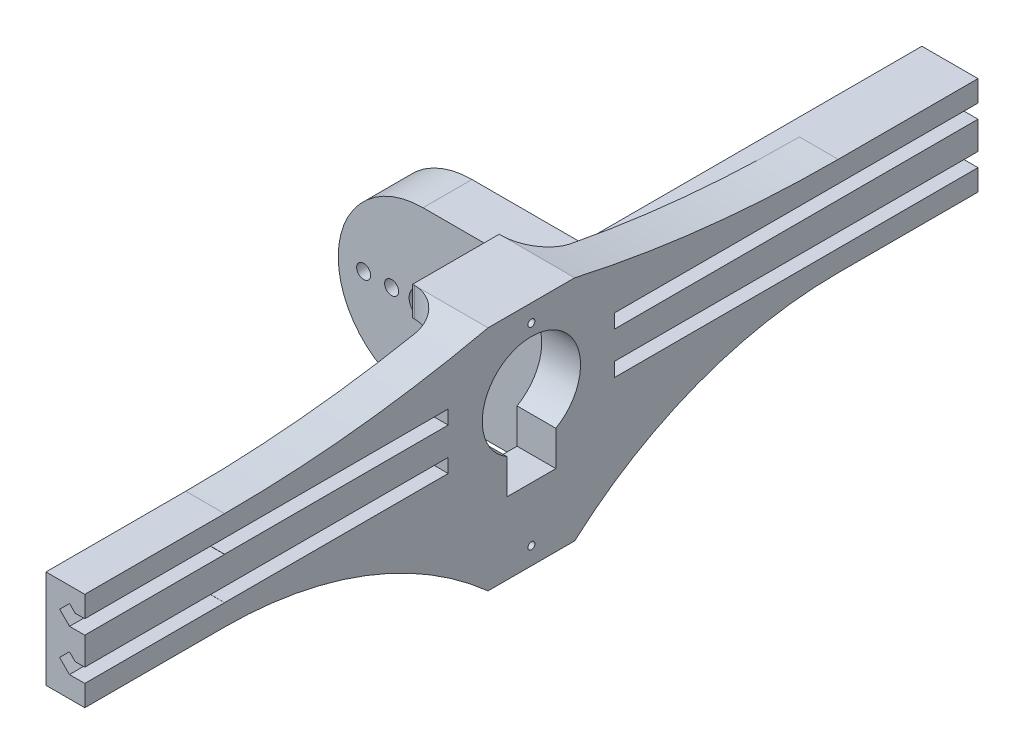
from build123d import *

# Parameters (mm, degrees)
SKETCH1_R               = 2
BOSS_EXTRUDE3_DEPTH     = 7
SKETCH3_R               = 1.0000000000000002
SKETCH3_R_2             = 0.9999999999999998
SKETCH3_R_3             = 0.9999999999999996
SKETCH3_R_4             = 0.9999999999999993
CUT_EXTRUDE2_DEPTH      = 26.09227496303999
BOSS_EXTRUDE4_START     = -7
BOSS_EXTRUDE4_DEPTH     = 7
BOSS_EXTRUDE5_START     = -30
BOSS_EXTRUDE5_DEPTH     = 30
FILLET2_R               = 1.5
CUT_EXTRUDE5_DEPTH      = 42.36510924463761
BOSS_EXTRUDE6_DEPTH     = 10.5
MOVE_START              = -28.7
MOVE_FACE1_DEPTH        = 5.7
DELETEFACE1_START       = 23.7
DELETEFACE1_OUTLINE_W   = 10.499999999999998
DELETEFACE1_OUTLINE_H   = 35.699999999999996
DELETEFACE1_DEPTH       = 15.7
SKETCH11_OUTSIDE_W      = 51.876
SKETCH11_OUTSIDE_H      = 42.462
CUT_EXTRUDE6_DEPTH      = 46.16926949380307
SERVO_START             = -12.760864102
SERVO_MICRO_OUTLINE_W   = 22.6
SERVO_MICRO_OUTLINE_H   = 12.399999999999999
SERVO_MICRO_DEPTH       = 22.3
SERVO_START_2           = 9.539135898
SERVO_MICRO_2_DEPTH     = 4.3
SERVO_START_3           = 2.889135898
SERVO_MICRO_3_DEPTH     = 2.4
SERVO_START_4           = 13.839135898
SERVO_MICRO_4_OUTLINE_R = 2.5
SERVO_MICRO_4_DEPTH     = 3.3
SERVO_START_5           = -25.667487826
SERVO_MICRO_5_OUTLINE_R = 0.6
SERVO_MICRO_5_DEPTH     = 2.3
SERVO_MICRO_6_OUTLINE_R = 0.6
SERVO_MICRO_6_DEPTH     = 2.3
SERVO_MICRO_7_OUTLINE_R = 0.6
SERVO_MICRO_7_DEPTH     = 2.3
BODY_MOVE_COPY1_ANGLE   = 90
SKETCH13_R              = 0.5000000000000009
SKETCH13_W              = 12.399999999999997
SKETCH13_H              = 4.17
SKETCH13_H_2            = 4.160545319150279
BOSS_EXTRUDE7_DEPTH     = 5.55
SKETCH13_3_W            = 12.399999999999997
SKETCH13_3_H            = 4.17
SKETCH13_3_R            = 0.5000000000000009
SKETCH13_3_H_2          = 4.160545319150279
BOSS_EXTRUDE8_DEPTH     = 10.8
CUT_EXTRUDE7_DEPTH      = 32
BOSS_EXTRUDE9_DEPTH     = 5.55
CUT_EXTRUDE8_DEPTH      = 72.0125468998838
BOSS_EXTRUDE10_DEPTH    = 5.55
FILLET8_START           = 12.13472734
FILLET8_DEPTH           = 2.98662
FILLET8_START_2         = -16.295273118
FILLET8_2_DEPTH         = 4.160545778
FILLET8_START_3         = 15.12134734
FILLET8_3_DEPTH         = 1.18338
FILLET8_START_4         = -7.24411042
FILLET8_4_DEPTH         = 25.39411042
FILLET9_R               = 1
SKETCH19_W              = 5.550000000000004
SKETCH19_H              = 14.059999999999988
BOSS_EXTRUDE11_DEPTH    = 20
CUT_EXTRUDE9_DEPTH      = 20
SKETCH21_W              = 8.027459463040207
SKETCH21_H              = 14.059999999999993
BOSS_EXTRUDE12_DEPTH    = 20
CUT_EXTRUDE10_DEPTH     = 20


with BuildPart() as part:
    # Sketch1 → Boss-Extrude3 (new body)
    with BuildSketch(Plane.XY):
        with BuildLine():
            Line((5.606455718863049, 13.824363162033857), (-15.462379801128069, 15.791841653866829))
            Line((-15.462379801128069, 15.791841653866829), (-15.46237980112806, -15.791841653866806))
            Line((-15.46237980112806, -15.791841653866806), (5.606455718863063, -13.824363162033817))
            ThreePointArc((5.606455718863063, -13.824363162033817), (18.200000000000003, 2.613e-14), (5.606455718863049, 13.824363162033857))
        make_face()
        Circle(SKETCH1_R, mode=Mode.SUBTRACT)
    extrude(amount=BOSS_EXTRUDE3_DEPTH)

    # Sketch3 → Cut-Extrude2 (cut, through all)
    with BuildSketch(Plane.XY.offset(7)):
        with Locations((-4.5, 0)):
            Circle(SKETCH3_R)
        with Locations((-8.499999999999998, 0)):
            Circle(SKETCH3_R_2)
        with Locations(Location((4.5, -1.73e-15, 0), (0, 0, 180))):
            Circle(SKETCH3_R_3)
        with Locations(Location((8.499999999999998, -1.73e-15, 0), (0, 0, 180))):
            Circle(SKETCH3_R_4)
    extrude(amount=-CUT_EXTRUDE2_DEPTH, mode=Mode.SUBTRACT)

    # Sketch6 → Boss-Extrude4 (add)
    with BuildSketch(Plane.XY.offset(7).offset(BOSS_EXTRUDE4_START)):
        with BuildLine():
            Line((12.20372638619735, 13.208287910486863), (5.606455718863047, 13.824363162033858))
            ThreePointArc((5.606455718863047, 13.82436316203386), (18.2, 2.598e-14), (5.606455718863056, -13.824363162033816))
            Line((5.606455718863056, -13.824363162033816), (12.203726386197348, -13.208287910486817))
            ThreePointArc((12.203726386197348, -13.208287910486817), (19.699999999999996, 2.132e-14), (12.20372638619735, 13.20828791048686))
        make_face()
    extrude(amount=BOSS_EXTRUDE4_DEPTH)

    # Sketch6<3> → Boss-Extrude5 (add)
    with BuildSketch(Plane.XY.offset(7).offset(BOSS_EXTRUDE5_START)):
        with BuildLine():
            Line((23.700000000000006, 12.13472734042489), (12.20372638619735, 13.208287910486863))
            ThreePointArc((12.20372638619735, 13.20828791048686), (19.699999999999996, 2.132e-14), (12.203726386197348, -13.208287910486817))
            Line((12.203726386197348, -13.208287910486817), (23.700000000000003, -12.134727340424835))
            Line((23.700000000000003, -12.134727340424835), (23.700000000000006, 12.134727340424892))
        make_face()
    extrude(amount=BOSS_EXTRUDE5_DEPTH)

    # Fillet2
    fillet2_edges = [part.edges().sort_by_distance(p)[0] for p in [
        (12.20372638619735, -13.208287910486817, -11.5),
        (12.20372638619735, 13.208287910486861, -11.5),
    ]]
    fillet(fillet2_edges, radius=FILLET2_R)

    # Sketch8 → Cut-Extrude5 (cut, through all)
    with BuildSketch(Plane.XY.offset(7)):
        with BuildLine():
            Line((-15.462379801128069, 15.791841653866829), (-15.46237980112806, -15.791841653866808))
            Line((-15.46237980112806, -15.791841653866806), (1.328273056892355, -14.223874201150027))
            ThreePointArc((1.3282730568923518, -14.22387420115002), (-14.285758873920813, 0), (1.3282730568923529, 14.22387420115002))
            Line((1.3282730568923604, 14.223874201150062), (-15.462379801128069, 15.791841653866829))
        make_face()
    extrude(amount=-CUT_EXTRUDE5_DEPTH, mode=Mode.SUBTRACT)

    # Sketch10 → Boss-Extrude6 (add)
    with BuildSketch(Plane.ZX.offset(1.6347273404248903)):
        Polygon((7, 23.700000000000003), (7, 39.40000000018666), (-28.700000000000003, 39.40000000018665), (-28.700000000000014, 23.700000000000003), align=None)
    extrude(amount=BOSS_EXTRUDE6_DEPTH)

    # Move Face1: read off the stored shape, not the designer's step
    # Move Face1 outline → Move Face1 (add)
    with BuildSketch(Plane.XY.offset(MOVE_START)):
        with BuildLine():
            Line((17.033263706, -12.757289525), (23.7, -12.13472734))
            Line((23.7, -12.13472734), (23.7, 12.13472734))
            Line((23.7, 12.13472734), (17.033263706, 12.757289525))
            ThreePointArc((17.033263706, 12.757289525), (15.554272674, 11.938827155), (15.776353621, 10.263125757))
            ThreePointArc((15.776353621, 10.263125757), (19.7, 0), (15.776353621, -10.263125757))
            ThreePointArc((15.776353621, -10.263125757), (15.554272674, -11.938827155), (17.033263706, -12.757289525))
        make_face()
    extrude(amount=MOVE_FACE1_DEPTH)

    # DeleteFace1: read off the stored shape, not the designer's step
    # DeleteFace1 outline → DeleteFace1 (cut)
    with BuildSketch(Plane.YZ.offset(DELETEFACE1_START)):
        with Locations((6.884727339999999, -10.849999999999998)):
            Rectangle(DELETEFACE1_OUTLINE_W, DELETEFACE1_OUTLINE_H)
    extrude(amount=DELETEFACE1_DEPTH, mode=Mode.SUBTRACT)

    # Sketch11 outside → Cut-Extrude6 (cut, through all)
    with BuildSketch(Plane.XY.offset(7)):
        with Locations((4.706999999999997, 0)):
            Rectangle(SKETCH11_OUTSIDE_W, SKETCH11_OUTSIDE_H)
        with BuildLine():
            Line((23.700000000000003, 12.134727340424888), (-1.43e-15, 12.134727340424885))
            ThreePointArc((-1.43e-15, 12.134727340424885), (-12.134727340424885, 1.49e-15), (0, -12.134727340424885))
            Line((0, -12.134727340424885), (23.700000000000006, -12.134727340424835))
            Line((23.700000000000006, -12.134727340424835), (23.700000000000003, 12.134727340424888))
        make_face(mode=Mode.SUBTRACT)
    extrude(amount=-CUT_EXTRUDE6_DEPTH, mode=Mode.SUBTRACT)

    # Sketch13 → Boss-Extrude7 (add)
    # profile 1 of 3: a face of its own
    with BuildSketch(Plane(origin=(23.700000000000003, -3.39e-15, 0), x_dir=(0, 0, -1), z_dir=(1, -1.4e-16, 0))):
        Polygon((-9.000000000000002, -16.295272659575108), (-9.000000000000002, -12.134727340424831), (-7, -12.134727340424831), (-6.999999999999999, 12.134727340424892), (-9.000000000000002, 12.13472734042489), (-9.000000000000002, 16.30472734042489), (-21.4, 16.30472734042489), (-21.4, 12.13472734042489), (-59.100000000000016, 12.134727340424885), (-59.100000000000016, -12.134727340424831), (-21.4, -12.134727340424831), (-21.4, -16.295272659575108), align=None)
        with Locations(Location((-15.200000000000001, 13.80472734042489, 0), (0, 0, 90))):
            Circle(SKETCH13_R, mode=Mode.SUBTRACT)
        with Locations(Location((-15.200000000000001, -13.79527265957511, 0), (0, 0, 90))):
            Circle(SKETCH13_R, mode=Mode.SUBTRACT)
        with BuildLine():
            ThreePointArc((-11.700000000000001, -0.9920668991734916), (-15.199999999999998, 12.13472734042489), (-18.700000000000003, -0.9920668991734924))
            Line((-18.700000000000003, -0.9920668991734924), (-18.700000000000003, -5.9920668991734924))
            Line((-18.700000000000003, -5.9920668991734924), (-11.700000000000003, -5.992066899173492))
            Line((-11.700000000000003, -5.992066899173492), (-11.700000000000001, -0.9920668991734916))
        make_face(mode=Mode.SUBTRACT)
    # profile 2 of 3: a face of its own
    with BuildSketch(Plane(origin=(23.700000000000003, -3.39e-15, 0), x_dir=(0, 0, -1), z_dir=(1, -1.4e-16, 0))):
        with Locations((-15.2, 14.219727340424889)):
            Rectangle(SKETCH13_W, SKETCH13_H)
        with Locations(Location((-15.200000000000001, 13.80472734042489, 0), (0, 0, 90))):
            Circle(SKETCH13_R, mode=Mode.SUBTRACT)
    # profile 3 of 3: a face of its own
    with BuildSketch(Plane(origin=(23.700000000000003, -3.39e-15, 0), x_dir=(0, 0, -1), z_dir=(1, -1.4e-16, 0))):
        with Locations((-15.2, -14.214999999999968)):
            Rectangle(SKETCH13_W, SKETCH13_H_2)
        with Locations(Location((-15.200000000000001, -13.79527265957511, 0), (0, 0, 90))):
            Circle(SKETCH13_R, mode=Mode.SUBTRACT)
    extrude(amount=-BOSS_EXTRUDE7_DEPTH)

    # Sketch13<3> → Boss-Extrude8 (add)
    # profile 1 of 2: a face of its own
    with BuildSketch(Plane(origin=(23.700000000000003, -3.39e-15, 0), x_dir=(0, 0, -1), z_dir=(1, -1.4e-16, 0))):
        with Locations((-15.2, 14.219727340424889)):
            Rectangle(SKETCH13_3_W, SKETCH13_3_H)
        with Locations(Location((-15.200000000000001, 13.80472734042489, 0), (0, 0, 90))):
            Circle(SKETCH13_3_R, mode=Mode.SUBTRACT)
    # profile 2 of 2: a face of its own
    with BuildSketch(Plane(origin=(23.700000000000003, -3.39e-15, 0), x_dir=(0, 0, -1), z_dir=(1, -1.4e-16, 0))):
        with Locations((-15.2, -14.214999999999968)):
            Rectangle(SKETCH13_3_W, SKETCH13_3_H_2)
        with Locations(Location((-15.200000000000001, -13.79527265957511, 0), (0, 0, 90))):
            Circle(SKETCH13_3_R, mode=Mode.SUBTRACT)
    extrude(amount=-BOSS_EXTRUDE8_DEPTH)

    # Sketch15 → Cut-Extrude7 (cut)
    with BuildSketch(Plane(origin=(1.903e-14, 0, -28.70000000000003), x_dir=(-1, 0, -6.6e-16), z_dir=(6.6e-16, 0, -1))):
        Polygon((-22.328427124746177, 3.104727340424887), (-23.699999999999985, 3.104727340424887), (-23.699999999999985, 1.1047273404248876), (-21.499999999999986, 1.1047273404248876), (-20.08578643762689, 2.5189409027979854), (-21.49999999999999, 3.9331544651710773), align=None)
        Polygon((-22.328427124746177, 9.104727340424887), (-23.699999999999985, 9.104727340424887), (-23.699999999999985, 7.104727340424887), (-21.499999999999986, 7.104727340424887), (-20.08578643762689, 8.518940902797986), (-21.49999999999999, 9.933154465171077), align=None)
    cut_extrude7 = extrude(amount=-CUT_EXTRUDE7_DEPTH, mode=Mode.SUBTRACT)

    # Mirror1: Cut-Extrude7 across plane
    add(cut_extrude7.mirror(Plane(origin=(0, 0, 15.200000000000001), x_dir=(1, 0, 0), z_dir=(0, 0, -1))), mode=Mode.SUBTRACT)

    # Sketch16 → Boss-Extrude9 (add)
    with BuildSketch(Plane(origin=(23.700000000000003, -3.39e-15, 0), x_dir=(0, 0, -1), z_dir=(1, -1.4e-16, 0))):
        with BuildLine():
            Line((-21.4, 12.13472734042489), (-21.4, 16.30472734042489))
            ThreePointArc((-21.4, 16.30472734042489), (-40.135039546574305, 13.18039662240372), (-59.100000000000016, 12.134727340424885))
            Line((-59.100000000000016, 12.134727340424885), (-21.4, 12.13472734042489))
        make_face()
        with BuildLine():
            Line((-9.000000000000002, 16.30472734042489), (-9.000000000000002, 12.13472734042489))
            Line((-9.000000000000002, 12.13472734042489), (28.700000000000014, 12.134727340424892))
            ThreePointArc((28.700000000000014, 12.134727340424892), (9.735039546574328, 13.180396622403777), (-9.000000000000002, 16.30472734042489))
        make_face()
    extrude(amount=-BOSS_EXTRUDE9_DEPTH)

    # Sketch18 → Cut-Extrude8 (cut, through all)
    with BuildSketch(Plane(origin=(23.700000000000003, -3.39e-15, 0), x_dir=(0, 0, -1), z_dir=(1, -1.4e-16, 0))):
        with BuildLine():
            Line((-59.100000000000016, -12.134727340424831), (-26.661429094135563, -12.134727340424831))
            ThreePointArc((-26.661429094135563, -12.134727340424838), (-42.096369157624615, -4.537893974213425), (-59.100000000000016, -1.9252726595751))
            Line((-59.100000000000016, -1.9252726595751037), (-59.100000000000016, -12.134727340424831))
        make_face()
        with BuildLine():
            Line((-3.7385709058644423, -12.134727340424831), (28.700000000000003, -12.134727340424831))
            Line((28.700000000000003, -12.134727340424831), (28.700000000000003, -1.9252726595751037))
            ThreePointArc((28.700000000000003, -1.9252726595751), (11.69636915762461, -4.537893974213425), (-3.738570905864435, -12.134727340424838))
        make_face()
    extrude(amount=-CUT_EXTRUDE8_DEPTH, mode=Mode.SUBTRACT)

    # Sketch18<3> → Boss-Extrude10 (add)
    with BuildSketch(Plane(origin=(23.700000000000003, -3.39e-15, 0), x_dir=(0, 0, -1), z_dir=(1, -1.4e-16, 0))):
        with BuildLine():
            ThreePointArc((-26.661429094135563, -12.134727340424838), (-23.96906894889605, -14.137042924937433), (-21.4, -16.295272659575097))
            Line((-21.4, -16.295272659575108), (-21.4, -12.134727340424831))
            Line((-21.4, -12.134727340424831), (-26.66142909413556, -12.134727340424831))
        make_face()
        with BuildLine():
            ThreePointArc((-9, -16.295272659575097), (-6.430931051103947, -14.137042924937433), (-3.738570905864435, -12.134727340424838))
            Line((-3.7385709058644423, -12.134727340424831), (-9.000000000000005, -12.134727340424831))
            Line((-9.000000000000005, -12.134727340424831), (-9.000000000000005, -16.295272659575108))
        make_face()
    extrude(amount=-BOSS_EXTRUDE10_DEPTH)

    # Fillet8: read off the stored shape, not the designer's step
    # Fillet8 outline → Fillet8 (add)
    with BuildSketch(Plane(origin=(0, 0, 0), x_dir=(1, 0, 0), z_dir=(0, 1, 0)).offset(FILLET8_START)):
        with BuildLine():
            Line((13.15, -9), (18.15, -9))
            Line((18.15, -9), (18.15, -4))
            ThreePointArc((18.15, -4), (16.685533906, -7.535533906), (13.15, -9))
        make_face()
        with BuildLine():
            ThreePointArc((13.15, -21.4), (16.685533906, -22.864466094), (18.15, -26.4))
            Line((18.15, -26.4), (18.15, -21.4))
            Line((18.15, -21.4), (13.15, -21.4))
        make_face()
    extrude(amount=FILLET8_DEPTH)

    # Fillet8 2 outline → Fillet8 2 (add)
    with BuildSketch(Plane(origin=(0, 0, 0), x_dir=(1, 0, 0), z_dir=(0, 1, 0)).offset(FILLET8_START_2)):
        with BuildLine():
            Line((13.15, -9), (18.15, -9))
            Line((18.15, -9), (18.15, -4))
            ThreePointArc((18.15, -4), (16.685533906, -7.535533906), (13.15, -9))
        make_face()
        with BuildLine():
            ThreePointArc((13.15, -21.4), (16.685533906, -22.864466094), (18.15, -26.4))
            Line((18.15, -26.4), (18.15, -21.4))
            Line((18.15, -21.4), (13.15, -21.4))
        make_face()
    extrude(amount=FILLET8_2_DEPTH)

    # Fillet8 3 outline → Fillet8 3 (add)
    with BuildSketch(Plane(origin=(0, 0, 0), x_dir=(1, 0, 0), z_dir=(0, 1, 0)).offset(FILLET8_START_3)):
        with BuildLine():
            Line((13.15, -9), (18.15, -9))
            Line((18.15, -9), (18.15, -4))
            ThreePointArc((18.15, -4), (16.685533906, -7.535533906), (13.15, -9))
        make_face()
        with BuildLine():
            ThreePointArc((13.15, -21.4), (16.685533906, -22.864466094), (18.15, -26.4))
            Line((18.15, -26.4), (18.15, -21.4))
            Line((18.15, -21.4), (13.15, -21.4))
        make_face()
    extrude(amount=FILLET8_3_DEPTH)

    # Fillet8 4 outline → Fillet8 4 (cut)
    with BuildSketch(Plane.YZ.offset(FILLET8_START_4)):
        with BuildLine():
            ThreePointArc((-12.31848008, 4), (-14.236321945, 6.556116062), (-16.29527266, 9))
            Line((-16.29527266, 9), (-16.295273118, 4))
            Line((-16.295273118, 4), (-12.31848008, 4))
        make_face()
        with BuildLine():
            Line((16.30472734, 4), (16.30472734, 9))
            ThreePointArc((16.30472734, 9), (15.765062943, 6.503857829), (15.262410605, 4))
            Line((15.262410605, 4), (16.30472734, 4))
        make_face()
        with BuildLine():
            Line((-12.31848008, 26.4), (-16.295273118, 26.4))
            Line((-16.295273118, 26.4), (-16.29527266, 21.4))
            ThreePointArc((-16.29527266, 21.4), (-14.236321945, 23.843883938), (-12.31848008, 26.4))
        make_face()
        with BuildLine():
            Line((16.30472734, 26.4), (15.262410605, 26.4))
            ThreePointArc((15.262410605, 26.4), (15.765062943, 23.896142171), (16.30472734, 21.4))
            Line((16.30472734, 21.4), (16.30472734, 26.4))
        make_face()
    extrude(amount=FILLET8_4_DEPTH, mode=Mode.SUBTRACT)

    # Fillet9
    fillet9_edges = [part.edges().sort_by_distance(p)[0] for p in [
        (18.150000000000002, 2.76e-14, 7),
    ]]
    fillet(fillet9_edges, radius=FILLET9_R)

    # Sketch19 → Boss-Extrude11 (add)
    with BuildSketch(Plane.XY.offset(59.100000000000016)):
        with Locations((20.925, 5.104727340424887)):
            Rectangle(SKETCH19_W, SKETCH19_H)
    extrude(amount=BOSS_EXTRUDE11_DEPTH)

    # Sketch20 → Cut-Extrude9 (cut)
    with BuildSketch(Plane.XY.offset(79.10000000000002)):
        Polygon((23.722110207744855, 7.076488781049606), (23.722110207744855, 9.104727340424887), (22.32229877311573, 9.104727340424887), (21.522110207744838, 9.904915905795775), (20.107896645371763, 8.490702343422699), (21.522110207744856, 7.076488781049606), align=None)
        Polygon((23.70401004449683, 1.0934240658721006), (23.70401004449683, 3.104727340424886), (22.3211338946902, 3.104727340424886), (21.504010044496816, 3.92185119061827), (20.08979648212374, 2.507637628245194), (21.504010044496834, 1.0934240658721002), align=None)
    extrude(amount=-CUT_EXTRUDE9_DEPTH, mode=Mode.SUBTRACT)

    # Sketch21 → Boss-Extrude12 (add)
    with BuildSketch(Plane(origin=(1.903e-14, 0, -28.70000000000003), x_dir=(-1, 0, -6.6e-16), z_dir=(6.6e-16, 0, -1))):
        with Locations((-19.68627026847988, 5.10472734042489)):
            Rectangle(SKETCH21_W, SKETCH21_H)
    extrude(amount=BOSS_EXTRUDE12_DEPTH)

    # Sketch24 → Cut-Extrude10 (cut)
    with BuildSketch(Plane(origin=(4.21e-14, 0, -48.70000000000004), x_dir=(-1, 0, -8.6e-16), z_dir=(8.6e-16, 0, -1))):
        Polygon((-23.699999999999978, 9.104727340424887), (-22.32842712474612, 9.104727340424887), (-21.499999999999954, 9.933154465171054), (-20.085786437626883, 8.518940902797985), (-21.499999999999982, 7.104727340424887), (-23.699999999999978, 7.104727340424887), align=None)
        Polygon((-23.699999999999978, 3.104727340424887), (-22.32842712474617, 3.104727340424887), (-21.499999999999982, 3.9331544651710755), (-20.085786437626886, 2.518940902797982), (-21.499999999999982, 1.1047273404248876), (-23.699999999999978, 1.1047273404248874), align=None)
    extrude(amount=-CUT_EXTRUDE10_DEPTH, mode=Mode.SUBTRACT)


with BuildPart() as body_2:
    # Servo Micro: read off the stored shape, not the designer's step
    # Servo Micro outline → Servo Micro (new body)
    with BuildSketch(Plane(origin=(0, 0, 0), x_dir=(1, 0, 0), z_dir=(0, 1, 0)).offset(SERVO_START)):
        with Locations((-12.067487826, -26.388081974)):
            Rectangle(SERVO_MICRO_OUTLINE_W, SERVO_MICRO_OUTLINE_H)
    extrude(amount=SERVO_MICRO_DEPTH)

    # Servo Micro 2 outline → Servo Micro 2 (add)
    with BuildSketch(Plane(origin=(0, 0, 0), x_dir=(1, 0, 0), z_dir=(0, 1, 0)).offset(SERVO_START_2)):
        with BuildLine():
            ThreePointArc((-11.10082116, -25.109193568), (-23.367487826, -26.388081974), (-11.10082116, -27.666970381))
            ThreePointArc((-11.10082116, -27.666970381), (-9.567487826, -26.388081975), (-11.10082116, -25.109193568))
        make_face()
    extrude(amount=SERVO_MICRO_2_DEPTH)

    # Servo Micro 3 outline → Servo Micro 3 (add)
    with BuildSketch(Plane(origin=(0, 0, 0), x_dir=(1, 0, 0), z_dir=(0, 1, 0)).offset(SERVO_START_3)):
        with BuildLine():
            Line((2.567676828, -25.838081974), (4.232512174, -25.838081974))
            Line((4.232512174, -25.838081974), (4.232512174, -20.188081974))
            Line((4.232512174, -20.188081974), (-0.767487826, -20.188081974))
            Line((-0.767487826, -20.188081974), (-0.767487826, -32.588081974))
            Line((-0.767487826, -32.588081974), (4.232512174, -32.588081974))
            Line((4.232512174, -32.588081974), (4.232512174, -26.938081974))
            Line((4.232512174, -26.938081974), (2.567676828, -26.938081974))
            ThreePointArc((2.567676828, -26.938081974), (0.732512174, -26.388081974), (2.567676828, -25.838081974))
        make_face()
        with BuildLine():
            Line((-23.367487826, -32.588081974), (-23.367487826, -20.188081974))
            Line((-23.367487826, -20.188081974), (-28.367487826, -20.188081974))
            Line((-28.367487826, -20.188081974), (-28.367487826, -25.838081974))
            Line((-28.367487826, -25.838081974), (-26.702652481, -25.838081974))
            ThreePointArc((-26.702652481, -25.838081974), (-24.867487826, -26.388081974), (-26.702652481, -26.938081974))
            Line((-26.702652481, -26.938081974), (-28.367487826, -26.938081974))
            Line((-28.367487826, -26.938081974), (-28.367487826, -32.588081974))
            Line((-28.367487826, -32.588081974), (-23.367487826, -32.588081974))
        make_face()
    extrude(amount=SERVO_MICRO_3_DEPTH)

    # Servo Micro 4 outline → Servo Micro 4 (add)
    with BuildSketch(Plane(origin=(0, 0, 0), x_dir=(1, 0, 0), z_dir=(0, 1, 0)).offset(SERVO_START_4)):
        with Locations((-17.167487826, -26.388081974)):
            Circle(SERVO_MICRO_4_OUTLINE_R)
    extrude(amount=SERVO_MICRO_4_DEPTH)


with BuildPart() as body_3:
    # Servo Micro 5 outline → Servo Micro 5 (new body)
    with BuildSketch(Plane.YZ.offset(SERVO_START_5)):
        with Locations((-8.260864102, 25.188081974)):
            Circle(SERVO_MICRO_5_OUTLINE_R)
    extrude(amount=SERVO_MICRO_5_DEPTH)


with BuildPart() as body_4:
    # Servo Micro 6 outline → Servo Micro 6 (new body)
    with BuildSketch(Plane.YZ.offset(SERVO_START_5)):
        with Locations((-8.260864102, 27.588081974)):
            Circle(SERVO_MICRO_6_OUTLINE_R)
    extrude(amount=SERVO_MICRO_6_DEPTH)


with BuildPart() as body_5:
    # Servo Micro 7 outline → Servo Micro 7 (new body)
    with BuildSketch(Plane.YZ.offset(SERVO_START_5)):
        with Locations((-8.260864102, 26.388081974)):
            Circle(SERVO_MICRO_7_OUTLINE_R)
    extrude(amount=SERVO_MICRO_7_DEPTH)


with BuildPart() as body_2_1:
    # Body-Move/Copy1: read off the stored shape, not the designer's step
    # Body-Move/Copy1: moved
    add(body_2.part.moved(Location((12.0627605, 7.6108641, -11.188082))).rotate(Axis((0, 0, 0), (0, 0, -1)), BODY_MOVE_COPY1_ANGLE))


solid = part.part
